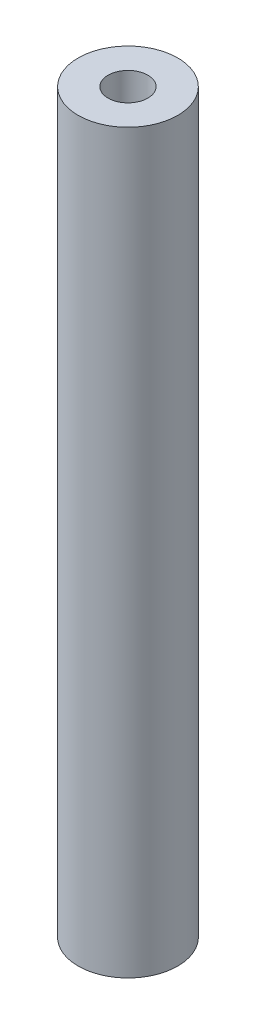
from build123d import *

# Parameters (mm, degrees)
SKETCH1_R           = 5
BOSS_EXTRUDE1_DEPTH = 74
CUT_EXTRUDE1_REACH  = 76.337
SKETCH2_R           = 2


with BuildPart() as part:
    # Sketch1 → Boss-Extrude1 (new body)
    with BuildSketch(Plane(origin=(0, 0, 0), x_dir=(1, 0, 0), z_dir=(0, 1, 0))):
        Circle(SKETCH1_R)
    extrude(amount=BOSS_EXTRUDE1_DEPTH)

    # Sketch2 → Cut-Extrude1 (cut, up to next)
    with BuildSketch(Plane(origin=(0, 74, 0), x_dir=(1, 0, 0), z_dir=(0, 1, 0)), mode=Mode.PRIVATE) as cut_extrude1_sk1:
        Circle(SKETCH2_R)
    cut_extrude1_tool1 = extrude(cut_extrude1_sk1.sketch, amount=-CUT_EXTRUDE1_REACH, mode=Mode.PRIVATE) & part.part
    add(cut_extrude1_tool1.solids().sort_by_distance((0, 74, 0))[0], mode=Mode.SUBTRACT)


solid = part.part
